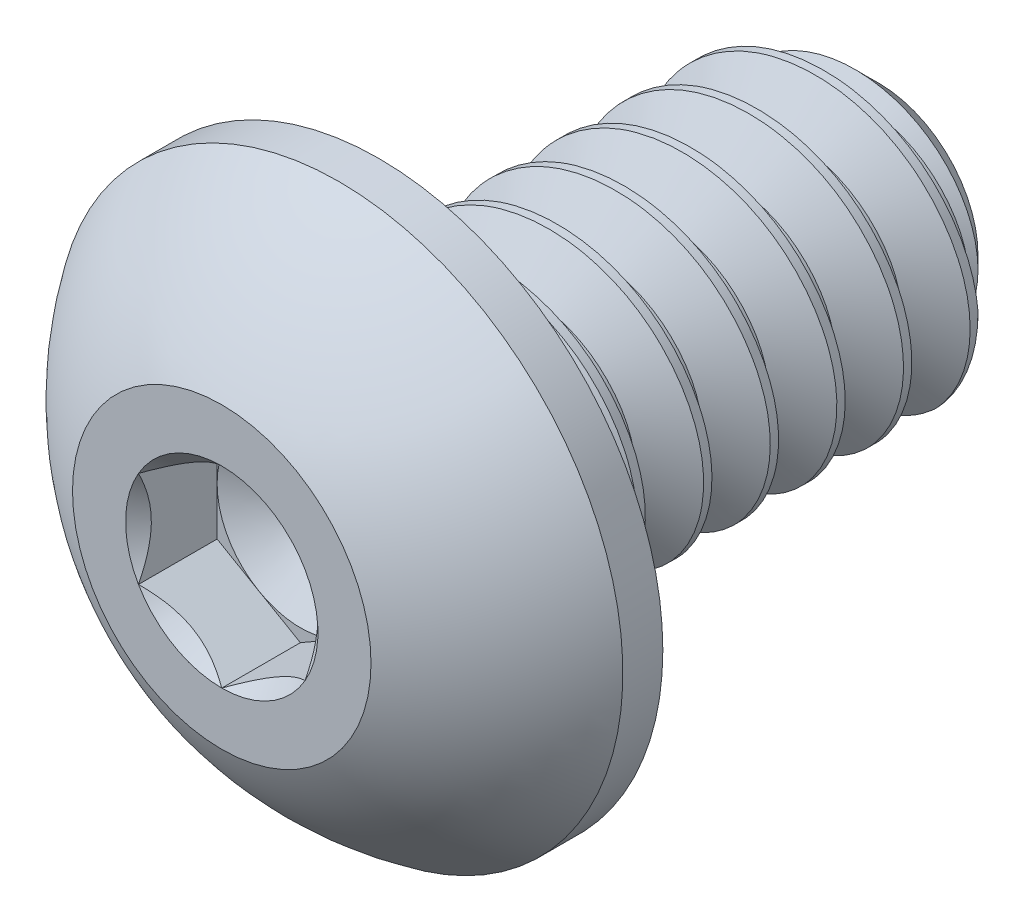
from build123d import *

# Parameters (mm, degrees)
SKETCH1_W          = 4.7625
SKETCH1_H          = 1.4224
CHAMFER1_SIZE      = 0.47625
CUT_SWEEP1_PITCH   = 0.635
SKETCH4_R          = 2.7051
EXTRUDE1_DEPTH     = 1.4986
CUT_EXTRUDE1_DEPTH = 0.7493
SKETCH7_R          = 0.916543552
CUT_EXTRUDE4_DEPTH = 0.7493
CUT_EXTRUDE4_DRAFT = -45
SKETCH8_R          = 0.79375
CUT_EXTRUDE5_DEPTH = 0.249766667
CUT_EXTRUDE5_DRAFT = -60


with BuildPart() as part:
    # Sketch1 → Revolve1 (revolve)
    with BuildSketch(Plane(origin=(0, 0, 0), x_dir=(0, 0, -1), z_dir=(1, 0, 0))):
        with Locations((2.38125, 0.7112)):
            Rectangle(SKETCH1_W, SKETCH1_H)
    revolve(axis=Axis((0, 0, 0), (0, 0, 1)))

    # Chamfer1
    chamfer1_edges = [part.edges().sort_by_distance(p)[0] for p in [
        (0, -1.4224, -4.7625),
    ]]
    chamfer(chamfer1_edges, length=CHAMFER1_SIZE)

    # Cut-Sweep1: arcs per turn and ends read off the stored shape
    # Cut-Sweep1: the profile of Sketch10 profile screwed along a right-hand helix through 12.5 turns, 6 arcs to a turn; built about Z, then put on its axis
    cut_sweep1_z = Axis((0, 0, 0), (0, 0, 1))
    cut_sweep1_corners = [(1.4227, 0, -0.079201795), (1.4227, 0, -0.635173205), (1.009955401, 0, -0.396875), (1.009955401, 0, -0.3175)]
    with BuildLine(mode=Mode.PRIVATE) as cut_sweep1_profile:
        Line(cut_sweep1_corners[0], cut_sweep1_corners[1])
        Line(cut_sweep1_corners[1], cut_sweep1_corners[2])
        Line(cut_sweep1_corners[2], cut_sweep1_corners[3])
        Line(cut_sweep1_corners[3], cut_sweep1_corners[0])
    cut_sweep1_cap = Face(cut_sweep1_profile.wire())
    cut_sweep1_turn_angles = [0, 30, 60, 90, 120, 150, 180, 210, 240, 270, 300, 330, 360]
    cut_sweep1_turn_weights = [1, 0.8660254037844387, 1, 0.8660254037844387, 1, 0.8660254037844387, 1, 0.8660254037844387, 1, 0.8660254037844387, 1, 0.8660254037844387, 1]
    cut_sweep1_turn_rails = [Edge.make_bspline([Vector(p[0], p[1], 0).rotate(cut_sweep1_z, cut_sweep1_turn_angles[k]) / cut_sweep1_turn_weights[k] + Vector(0, 0, p[2] + CUT_SWEEP1_PITCH * cut_sweep1_turn_angles[k] / 360) for k in range(13)], [0, 0, 0, 1, 1, 2, 2, 3, 3, 4, 4, 5, 5, 6, 6, 6], 2, cut_sweep1_turn_weights) for p in cut_sweep1_corners]
    cut_sweep1_turn_sides = [Face.make_surface_from_curves(cut_sweep1_turn_rails[p[0]], cut_sweep1_turn_rails[p[1]]) for p in [(0, 1), (1, 2), (2, 3), (3, 0)]]
    cut_sweep1_last_angles = [4320, 4350, 4380, 4410, 4440, 4470, 4500]
    cut_sweep1_last_weights = [1, 0.8660254037844387, 1, 0.8660254037844387, 1, 0.8660254037843435, 1]
    cut_sweep1_last_rails = [Edge.make_bspline([Vector(p[0], p[1], 0).rotate(cut_sweep1_z, cut_sweep1_last_angles[k]) / cut_sweep1_last_weights[k] + Vector(0, 0, p[2] + CUT_SWEEP1_PITCH * cut_sweep1_last_angles[k] / 360) for k in range(7)], [0, 0, 0, 1, 1, 2, 2, 3, 3, 3], 2, cut_sweep1_last_weights) for p in cut_sweep1_corners]
    cut_sweep1_last_sides = [Face.make_surface_from_curves(cut_sweep1_last_rails[p[0]], cut_sweep1_last_rails[p[1]]) for p in [(0, 1), (1, 2), (2, 3), (3, 0)]]
    cut_sweep1 = Plane(origin=(0, 0, -4.7625), x_dir=(0.7071067811865488, 0.7071067811865462, 0), z_dir=(0, 0, 1)) * Solid(Shell([*[p.moved(Location((0, 0, CUT_SWEEP1_PITCH * i))) for i in range(12) for p in cut_sweep1_turn_sides], *cut_sweep1_last_sides, cut_sweep1_cap, cut_sweep1_cap.rotate(cut_sweep1_z, 4500).moved(Location((0, 0, CUT_SWEEP1_PITCH * 4500 / 360)))]))
    add(cut_sweep1, mode=Mode.SUBTRACT)

    # Sketch4 → Extrude1 (add)
    with BuildSketch(Plane.XY):
        Circle(SKETCH4_R)
    extrude(amount=EXTRUDE1_DEPTH)

    # Sketch9 → Cut-Revolve3 (revolve, cut)
    with BuildSketch(Plane(origin=(0, 0, 0), x_dir=(0, 0, -1), z_dir=(1, 0, 0)), mode=Mode.PRIVATE) as cut_revolve3_sk:
        with BuildLine():
            Line((0, 2.7051), (-0.381, 2.7051))
            ThreePointArc((-0.381, 2.7051), (-1.025093234, 2.138064897), (-1.4986, 1.4224))
            Line((-1.4986, 1.4224), (-1.8796, 1.4224))
            Line((-1.8796, 1.4224), (-1.8796, 3.0861))
            Line((-1.8796, 3.0861), (0, 3.0861))
            Line((0, 3.0861), (0, 2.7051))
        make_face()
    revolve(cut_revolve3_sk.sketch.rotate(Axis((0, 0, 0), (0, 0, 1)), 170.90536533), axis=Axis((0, 0, 0), (0, 0, 1)), mode=Mode.SUBTRACT)

    # Sketch6 → Cut-Extrude1 (cut)
    with BuildSketch(Plane.XY.offset(1.4986)):
        Polygon((0, -0.916543552), (0.79375, -0.458271776), (0.79375, 0.458271776), (0, 0.916543552), (-0.79375, 0.458271776), (-0.79375, -0.458271776), align=None)
    extrude(amount=-CUT_EXTRUDE1_DEPTH, mode=Mode.SUBTRACT)


with BuildPart() as cut_extrude4_tool:
    # Sketch7 → Cut-Extrude4 (with draft: the straight prism first)
    with BuildSketch(Plane.XY.offset(1.4986)):
        Circle(SKETCH7_R)
    extrude(amount=-CUT_EXTRUDE4_DEPTH)
    # Cut-Extrude4: the draft: its side faces are tilted about the plane it starts from
    cut_extrude4_sides = [cut_extrude4_tool.faces().sort_by_distance(p)[0] for p in [
        (-0.916543552, 0, 1.12395),
    ]]
    draft(cut_extrude4_sides, Plane.XY.offset(1.4986), CUT_EXTRUDE4_DRAFT)


with BuildPart() as part_1:
    add(part.part)

    # Cut-Extrude4: cut by cut_extrude4_tool
    add(cut_extrude4_tool.part, mode=Mode.SUBTRACT)


with BuildPart() as cut_extrude5_tool:
    # Sketch8 → Cut-Extrude5 (with draft: the straight prism first)
    with BuildSketch(Plane.XY.offset(0.7493)):
        Circle(SKETCH8_R)
    extrude(amount=-CUT_EXTRUDE5_DEPTH)
    # Cut-Extrude5: the draft: its side faces are tilted about the plane it starts from
    cut_extrude5_sides = [cut_extrude5_tool.faces().sort_by_distance(p)[0] for p in [
        (-0.79375, 0, 0.624416667),
    ]]
    draft(cut_extrude5_sides, Plane.XY.offset(0.7493), CUT_EXTRUDE5_DRAFT)


with BuildPart() as part_2:
    add(part_1.part)

    # Cut-Extrude5: cut by cut_extrude5_tool
    add(cut_extrude5_tool.part, mode=Mode.SUBTRACT)


solid = part_2.part
